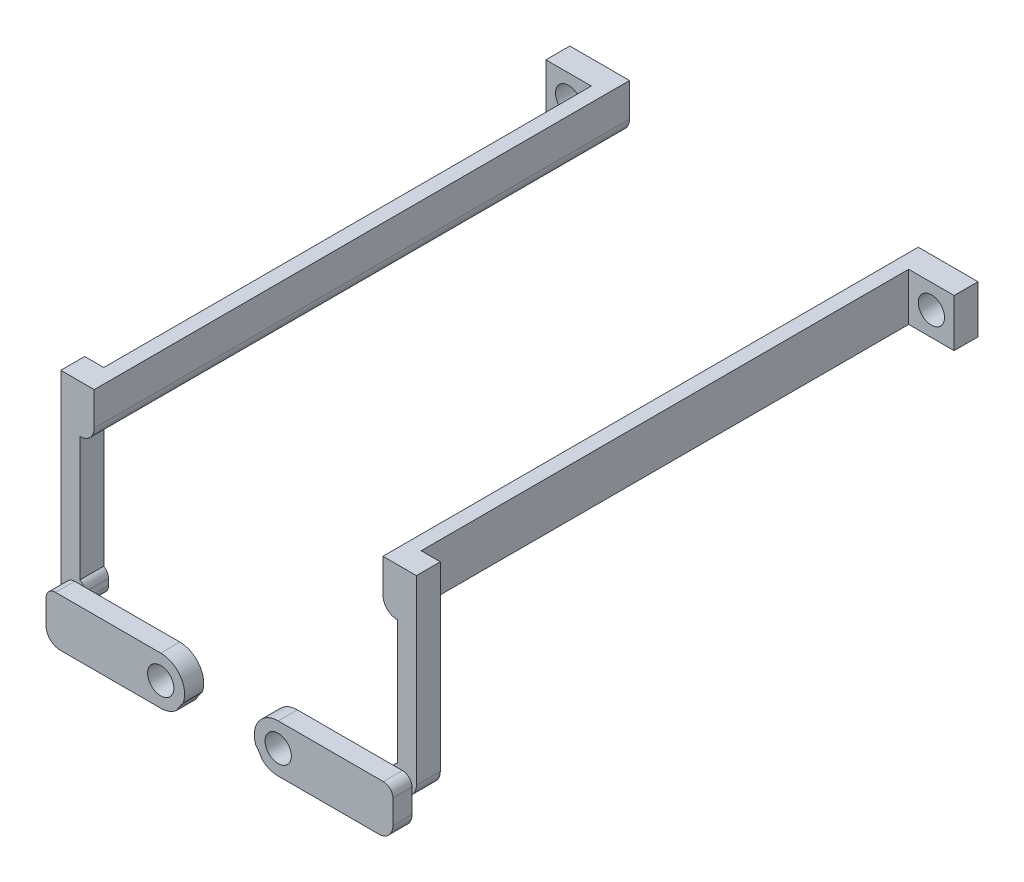
from build123d import *

# Parameters (mm, degrees)
SKETCH1_R               = 2.75
BOSS_EXTRUDE1_DEPTH     = 5
BOSS_EXTRUDE1_2_DEPTH   = 5
BOSS_EXTRUDE2_DEPTH     = 5
BOSS_EXTRUDE2_2_DEPTH   = 5
BOSS_EXTRUDE3_DEPTH     = 102
SKETCH4_W               = 5.5
SKETCH4_H               = 10
CUT_EXTRUDE1_DEPTH      = 5
BOSS_EXTRUDE4_OUTLINE_R = 2.75
BOSS_EXTRUDE4_DEPTH     = 4
FILLET1_R               = 3
FILLET2_R               = 3
FILLET3_R               = 2
FILLET4_R               = 2
FILLET5_R               = 2
FILLET6_R               = 2
FILLET7_R               = 2
FILLET8_R               = 2
CUT_EXTRUDE2_DEPTH      = 5


# Read off the part's stored shape, not the designer's step: Boss-Extrude4
# Some blends are built 0.0001 mm under size
with BuildPart() as part:
    # Sketch1 → Boss-Extrude1 (new body)
    with BuildSketch(Plane.XY.offset(108)):
        with BuildLine():
            Line((30.2, 50), (30.2, 43))
            ThreePointArc((30.2, 43), (31.078679656, 40.878679656), (33.2, 40))
            Line((33.2, 40), (33.2, 14))
            Line((33.2, 14), (32.2, 14))
            Line((32.2, 14), (32.2, 9))
            Line((32.2, 9), (37.2, 9))
            Line((37.2, 9), (37.2, 40))
            Line((37.2, 40), (42.7, 40))
            Line((42.7, 40), (42.7, 50))
            Line((42.7, 50), (30.2, 50))
        make_face()
        with Locations((37.95, 45)):
            Circle(SKETCH1_R, mode=Mode.SUBTRACT)
    extrude(amount=BOSS_EXTRUDE1_DEPTH)



with BuildPart() as body_2:
    # Sketch1 → Boss-Extrude1 2 (new body)
    with BuildSketch(Plane.XY.offset(108)):
        with BuildLine():
            Line((-37.2, 40), (-37.2, 9))
            Line((-37.2, 9), (-32.2, 9))
            Line((-32.2, 9), (-32.2, 14))
            Line((-32.2, 14), (-33.2, 14))
            Line((-33.2, 14), (-33.2, 40))
            ThreePointArc((-33.2, 40), (-31.078679656, 40.878679656), (-30.2, 43))
            Line((-30.2, 43), (-30.2, 50))
            Line((-30.2, 50), (-42.7, 50))
            Line((-42.7, 50), (-42.7, 40))
            Line((-42.7, 40), (-37.2, 40))
        make_face()
        with Locations((-37.95, 45)):
            Circle(SKETCH1_R, mode=Mode.SUBTRACT)
    extrude(amount=BOSS_EXTRUDE1_2_DEPTH)


with BuildPart() as body_3:
    # Sketch2 → Boss-Extrude2 (new body)
    with BuildSketch(Plane.XY.offset(220)):
        with BuildLine():
            Line((42.7, 50), (30.2, 50))
            Line((30.2, 50), (30.2, 43))
            ThreePointArc((30.2, 43), (31.078679656, 40.878679656), (33.2, 40))
            Line((33.2, 40), (33.2, 14))
            Line((33.2, 14), (32.2, 14))
            Line((32.2, 14), (32.2, 9))
            Line((32.2, 9), (37.2, 9))
            Line((37.2, 9), (37.2, 40))
            Line((37.2, 40), (42.7, 40))
            Line((42.7, 40), (42.7, 50))
        make_face()
    extrude(amount=-BOSS_EXTRUDE2_DEPTH)


with BuildPart() as body_4:
    # Sketch2 → Boss-Extrude2 2 (new body)
    with BuildSketch(Plane.XY.offset(220)):
        with BuildLine():
            Line((-42.7, 40), (-37.2, 40))
            Line((-37.2, 40), (-37.2, 9))
            Line((-37.2, 9), (-32.2, 9))
            Line((-32.2, 9), (-32.2, 14))
            Line((-32.2, 14), (-33.2, 14))
            Line((-33.2, 14), (-33.2, 40))
            ThreePointArc((-33.2, 40), (-31.078679656, 40.878679656), (-30.2, 43))
            Line((-30.2, 43), (-30.2, 50))
            Line((-30.2, 50), (-42.7, 50))
            Line((-42.7, 50), (-42.7, 40))
        make_face()
    extrude(amount=-BOSS_EXTRUDE2_2_DEPTH)


with BuildPart() as part_1:
    add(part.part)

    add(body_2.part)  # Boss-Extrude3 merges body 2

    add(body_3.part)  # Boss-Extrude3 merges body 3

    add(body_4.part)  # Boss-Extrude3 merges body 4
    # Sketch3 → Boss-Extrude3 (add)
    with BuildSketch(Plane.XY.offset(113)):
        with BuildLine():
            ThreePointArc((30.2, 43), (31.078679656, 40.878679656), (33.2, 40))
            Line((33.2, 40), (33.2, 50))
            Line((33.2, 50), (30.2, 50))
            Line((30.2, 50), (30.2, 43))
        make_face()
        with BuildLine():
            Line((-33.2, 50), (-33.2, 40))
            ThreePointArc((-33.2, 40), (-31.078679656, 40.878679656), (-30.2, 43))
            Line((-30.2, 43), (-30.2, 50))
            Line((-30.2, 50), (-33.2, 50))
        make_face()
    extrude(amount=BOSS_EXTRUDE3_DEPTH)

    # Sketch4 → Cut-Extrude1 (cut)
    with BuildSketch(Plane.XY.offset(220)):
        with Locations((-39.95, 45)):
            Rectangle(SKETCH4_W, SKETCH4_H)
        with Locations((39.95, 45)):
            Rectangle(SKETCH4_W, SKETCH4_H)
    extrude(amount=-CUT_EXTRUDE1_DEPTH, mode=Mode.SUBTRACT)

    # Boss-Extrude4 outline → Boss-Extrude4 (add)
    # profile 1 of 2: a face of its own
    with BuildSketch(Plane.XY.offset(220)):
        with BuildLine():
            ThreePointArc((-7.588350384, 6.512828759), (-8.194576251, 11.087838135), (-12.288728005, 13.217660193))
            Line((-12.288728005, 13.217660193), (-36.288728005, 13.217660193))
            Line((-36.288728005, 13.217660193), (-36.288728005, 3.217660193))
            Line((-36.288728005, 3.217660193), (-12.288728005, 3.217660193))
            ThreePointArc((-12.288728005, 3.217660193), (-10.480879624, 3.555934737), (-8.917650877, 4.524986502))
            ThreePointArc((-8.917650877, 4.524986502), (-8.312634878, 5.558785963), (-7.588350384, 6.512828759))
        make_face()
        with Locations((-12.288728005, 8.217660193)):
            Circle(BOSS_EXTRUDE4_OUTLINE_R, mode=Mode.SUBTRACT)
    # profile 2 of 2: a face of its own
    with BuildSketch(Plane.XY.offset(220)):
        with BuildLine():
            Line((36.288728005, 3.217660193), (36.288728005, 13.217660193))
            Line((36.288728005, 13.217660193), (12.288728005, 13.217660193))
            ThreePointArc((12.288728005, 13.217660193), (8.194576251, 11.087838135), (7.588350384, 6.512828759))
            ThreePointArc((7.588350384, 6.512828759), (8.312634878, 5.558785963), (8.917650877, 4.524986502))
            ThreePointArc((8.917650877, 4.524986502), (10.480879624, 3.555934737), (12.288728005, 3.217660193))
            Line((12.288728005, 3.217660193), (36.288728005, 3.217660193))
        make_face()
        with Locations((12.288728005, 8.217660193)):
            Circle(BOSS_EXTRUDE4_OUTLINE_R, mode=Mode.SUBTRACT)
    extrude(amount=BOSS_EXTRUDE4_DEPTH)

    # Fillet1
    # the kernel refuses this fillet: 3 mm, written as the material it takes off along each edge
    with BuildSketch(Plane(origin=(-37.2, 9, 220), x_dir=(0, 1, 0), z_dir=(0, 0, -1))) as fillet1_piece_1:
        with BuildLine():
            CenterArc((FILLET1_R, FILLET1_R), FILLET1_R, 180, 90)
            Line((0, FILLET1_R), (0, 0))
            Line((0, 0), (FILLET1_R, 0))
        make_face()
    extrude(amount=12.5, mode=Mode.SUBTRACT)
    with BuildSketch(Plane(origin=(-36.288728005, 3.217660193, 212.5), x_dir=(0, 1, 0), z_dir=(0, 0, 1))) as fillet1_piece_2:
        with BuildLine():
            CenterArc((FILLET1_R, -FILLET1_R), FILLET1_R, 90, 90)
            Line((0, -FILLET1_R), (0, 0))
            Line((0, 0), (FILLET1_R, 0))
        make_face()
    extrude(amount=19, mode=Mode.SUBTRACT)

    # Fillet2
    # the kernel refuses this fillet: 3 mm, written as the material it takes off along each edge
    with BuildSketch(Plane(origin=(37.2, 9, 220), x_dir=(0, 1, 0), z_dir=(0, 0, -1))) as fillet2_piece_1:
        with BuildLine():
            CenterArc((FILLET2_R, -FILLET2_R), FILLET2_R, 90, 90)
            Line((0, -FILLET2_R), (0, 0))
            Line((0, 0), (FILLET2_R, 0))
        make_face()
    extrude(amount=12.5, mode=Mode.SUBTRACT)
    with BuildSketch(Plane(origin=(36.288728005, 3.217660193, 212.5), x_dir=(-1, 0, 0), z_dir=(0, 0, 1))) as fillet2_piece_2:
        with BuildLine():
            CenterArc((FILLET2_R, -FILLET2_R), FILLET2_R, 90, 90)
            Line((0, -FILLET2_R), (0, 0))
            Line((0, 0), (FILLET2_R, 0))
        make_face()
    extrude(amount=19, mode=Mode.SUBTRACT)

    # Fillet3
    fillet3_edges = [part_1.edges().sort_by_distance(p)[0] for p in [
        (36.288728005, 13.217660193, 222),
    ]]
    fillet(fillet3_edges, radius=FILLET3_R)

    # Fillet4
    fillet4_edges = [part_1.edges().sort_by_distance(p)[0] for p in [
        (-36.288728005, 13.217660193, 222),
    ]]
    fillet(fillet4_edges, radius=FILLET4_R)

    # Fillet5
    # the kernel refuses this fillet: 2 mm, written as the material it takes off along each edge
    with BuildSketch(Plane(origin=(-32.2, 14, 220), x_dir=(0, -1, 0), z_dir=(0, 0, -1))) as fillet5_piece_1:
        with BuildLine():
            CenterArc((1.732050808, 2), FILLET5_R, 210, 60)
            Line((0, 1), (-0.034641016, 0.98))
            ThreePointArc((-0.034641016, 0.98), (-0.04, 0.5), (-0.04, 0))
            Line((-0.04, 0), (0, -0.04))
            Line((0, -0.04), (1.732050808, -0.04))
            Line((1.732050808, -0.04), (1.732050808, 0))
        make_face()
    extrude(amount=9.330127019, mode=Mode.SUBTRACT)

    # Fillet6
    # the kernel refuses this fillet: 2 mm, written as the material it takes off along each edge
    with BuildSketch(Plane(origin=(32.2, 14, 220), x_dir=(1, 0, 0), z_dir=(0, 0, -1))) as fillet6_piece_1:
        with BuildLine():
            CenterArc((2, 1.732050808), FILLET6_R, 180, 60)
            Line((0, 1.732050808), (-0.04, 1.732050808))
            Line((-0.04, 1.732050808), (-0.04, 0))
            Line((-0.04, 0), (0, -0.04))
            ThreePointArc((0, -0.04), (0.5, -0.04), (0.98, -0.034641016))
            Line((0.98, -0.034641016), (1, 0))
        make_face()
    extrude(amount=9.330127019, mode=Mode.SUBTRACT)

    # Fillet7
    fillet7_edges = [part_1.edges().sort_by_distance(p)[0] for p in [
        (32.2, 9, 217.5),
    ]]
    fillet(fillet7_edges, radius=FILLET7_R - 0.0001)  # a hair under: the kernel refuses the full size

    # Fillet8
    fillet8_edges = [part_1.edges().sort_by_distance(p)[0] for p in [
        (-32.2, 9, 217.5),
    ]]
    fillet(fillet8_edges, radius=FILLET8_R - 0.0001)  # a hair under: the kernel refuses the full size

    # Sketch7 → Cut-Extrude2 (cut)
    with BuildSketch(Plane.XY.offset(113)):
        Polygon((-33.2, 40), (-37.2, 40), (-37.2, 9), (-32.2, 9), (-32.2, 14), (-33.2, 14), align=None)
        Polygon((32.2, 9), (37.2, 9), (37.2, 40), (33.2, 40), (33.2, 14), (32.2, 14), align=None)
    extrude(amount=-CUT_EXTRUDE2_DEPTH, mode=Mode.SUBTRACT)


solid = part_1.part
